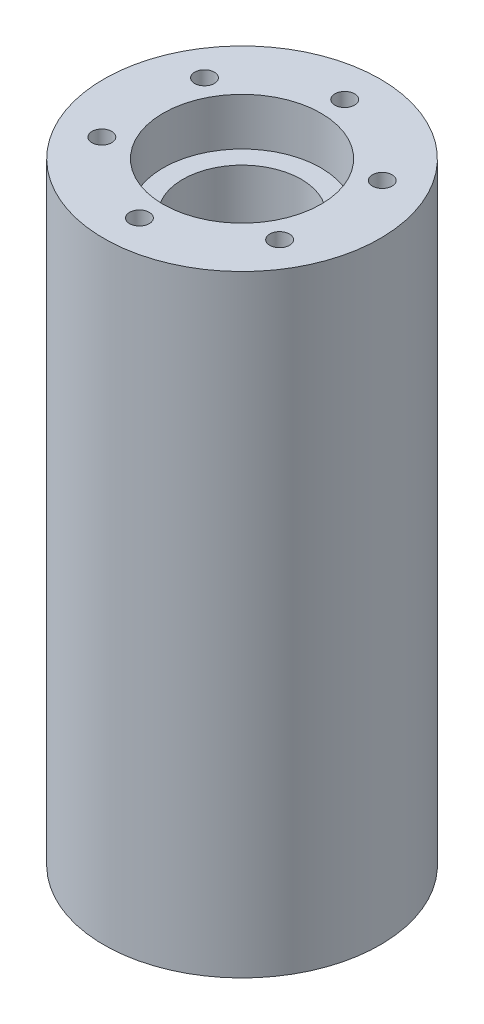
from build123d import *

# Parameters (mm, degrees)
SZYK_KO_OWY1_COUNT = 6
SZYK_KO_OWY2_COUNT = 6


with BuildPart() as part:
    # Szkic1 → Obrót1 (revolve)
    with BuildSketch(Plane(origin=(0, 0, 0), x_dir=(0, 0, -1), z_dir=(1, 0, 0))):
        Polygon((-23.5, -77.5), (-35, -77.5), (-35, 77.5), (-20, 77.5), (-20, 65.5), (-15, 65.5), (-15, -63.5), (-23.5, -63.5), align=None)
    revolve(axis=Axis((0, -77.5, 0), (0, 1, 0)))

    # Szkic3 → Otwór gwintowany M61 (revolve, cut)
    with BuildSketch(Plane(origin=(0, -77.5, -30), x_dir=(0, 0, -1), z_dir=(1, 0, 0))):
        Polygon((0, 0), (0, 18.502151548), (2.5, 17), (2.5, 0), align=None)
    otw_r_gwintowany_m61 = revolve(axis=Axis((0, -83.85, -30), (0, 1, 0)), mode=Mode.SUBTRACT)

    # Szyk kołowy1: Otwór gwintowany M61 ×6 about axis
    szyk_ko_owy1_axis = Axis((0, -77.5, 0), (0, -1, 0))
    for i in range(1, SZYK_KO_OWY1_COUNT):
        add(otw_r_gwintowany_m61.rotate(szyk_ko_owy1_axis, i * 360 / SZYK_KO_OWY1_COUNT), mode=Mode.SUBTRACT)

    # Szkic5 → Otwór gwintowany M62 (revolve, cut)
    with BuildSketch(Plane(origin=(0, 77.5, -26), x_dir=(0, 0, 1), z_dir=(1, 0, 0))):
        Polygon((0, 0), (0, 18.502151548), (2.5, 17), (2.5, 0), align=None)
    otw_r_gwintowany_m62 = revolve(axis=Axis((0, 83.85, -26), (0, -1, 0)), mode=Mode.SUBTRACT)

    # Szyk kołowy2: Otwór gwintowany M62 ×6 about axis
    szyk_ko_owy2_axis = Axis((0, -77.5, 0), (0, -1, 0))
    for i in range(1, SZYK_KO_OWY2_COUNT):
        add(otw_r_gwintowany_m62.rotate(szyk_ko_owy2_axis, i * 360 / SZYK_KO_OWY2_COUNT), mode=Mode.SUBTRACT)


solid = part.part
